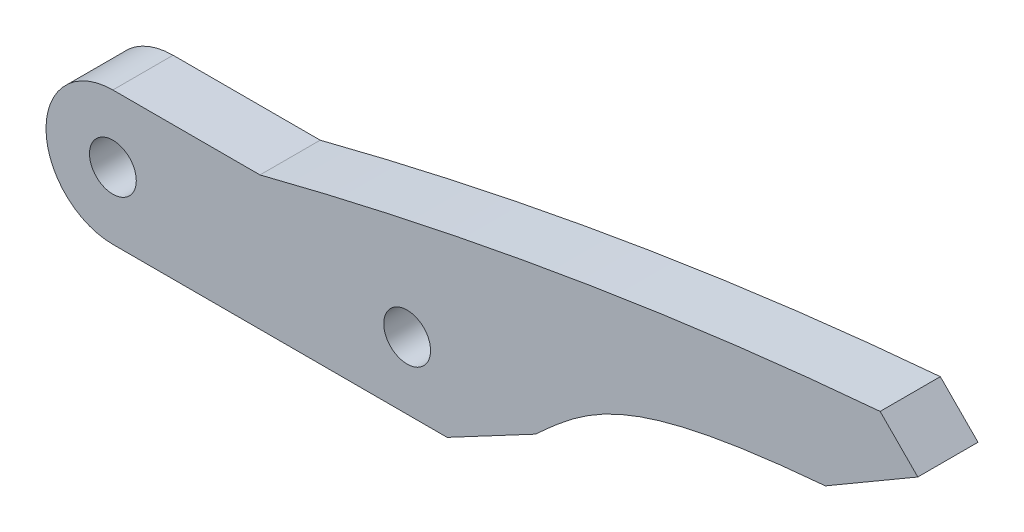
from build123d import *

# Parameters (mm, degrees)
SKETCH1_R           = 5
SKETCH1_R_2         = 1.75
BOSS_EXTRUDE1_DEPTH = 4.5
BOSS_EXTRUDE2_START = -4.5
BOSS_EXTRUDE2_DEPTH = 4.5
CUT_EXTRUDE3_START  = 2.2
CUT_EXTRUDE3_DEPTH  = 0.1


# Read off the part's stored shape, not the designer's step: Cut-Extrude3
with BuildPart() as part:
    # Sketch1 → Boss-Extrude1 (new body)
    # profile 1 of 3: a face of its own
    with BuildSketch(Plane.XY):
        with Locations((-11, 0)):
            Circle(SKETCH1_R)
        with Locations((-11, 0)):
            Circle(SKETCH1_R_2, mode=Mode.SUBTRACT)
    # profile 2 of 3: a face of its own
    with BuildSketch(Plane.XY):
        with Locations((11, 0)):
            Circle(SKETCH1_R)
        with Locations((11, 0)):
            Circle(SKETCH1_R_2, mode=Mode.SUBTRACT)
    # profile 3 of 3: a face of its own
    with BuildSketch(Plane.XY):
        with BuildLine():
            Line((11, 5), (-11, 5))
            ThreePointArc((-11, 5), (-7.464466094, 3.535533906), (-6, 0))
            ThreePointArc((-6, 0), (-7.464466094, -3.535533906), (-11, -5))
            Line((-11, -5), (11.000000019, -5))
            ThreePointArc((11.000000019, -5), (6, -9e-09), (11, 5))
        make_face()
    extrude(amount=BOSS_EXTRUDE1_DEPTH)

    # Sketch5 → Boss-Extrude2 (add)
    with BuildSketch(Plane.XY.offset(4.5).offset(BOSS_EXTRUDE2_START)):
        with BuildLine():
            Line((11, -5), (13.99, -5))
            Line((13.99, -5), (20.61, -1.48))
            add(Edge.make_bspline(
                [(42.27, 6), (27.826894641, 4.768168558), (24.733930665, 2.331798547), (20.61, -1.48)],
                knots=[0, 0, 0, 0, 1, 1, 1, 1], degree=3))
            Line((42.27, 6), (49.180795902, 10.03))
            Line((49.180795902, 10.03), (46.363989199, 12.87))
            add(Edge.make_bspline(
                [(0, 5), (22.856130072, 10.87555535), (46.363989199, 12.87)],
                knots=[0, 0, 0, 1, 1, 1], degree=2))
            Line((0, 5), (11, 5))
            ThreePointArc((11, 5), (16, 0), (11, -5))
        make_face()
    extrude(amount=BOSS_EXTRUDE2_DEPTH)

    # Cut-Extrude3 outline → Cut-Extrude3 (cut)
    with BuildSketch(Plane.XY.offset(CUT_EXTRUDE3_START)):
        with BuildLine():
            add(Edge.make_bspline(
                [(38.979397214, 11.642850201), (39.348659921, 11.684028726), (39.718010294, 11.724686129), (40.087448338, 11.76482241), (40.456974055, 11.804437571), (40.826587452, 11.843531609), (41.196288532, 11.882104526), (41.566077299, 11.920156321), (41.935953757, 11.957686995), (42.305917912, 11.994696547), (42.675969767, 12.031184976), (43.046109327, 12.067152283), (43.416336595, 12.102598468), (43.786651577, 12.13752353), (44.157054276, 12.17192747)],
                knots=[0.500328151, 0.500328151, 0.500328151, 0.500328151, 0.500328151, 0.500328151, 0.500328151, 0.500328151, 0.500328151, 0.500328151, 0.500328151, 0.500328151, 0.500328151, 0.500328151, 0.500328151, 0.500437892, 0.500437892, 0.500437892, 0.500437892, 0.500437892, 0.500437892, 0.500437892, 0.500437892, 0.500437892, 0.500437892, 0.500437892, 0.500437892, 0.500437892, 0.500437892, 0.500437892], degree=14))
            Line((38.979397214, 11.642850201), (42.27, 6))
            Line((42.27, 6), (46.363989199, 8.387391656))
            Line((46.363989199, 8.387391656), (44.157054276, 12.17192747))
        make_face()
    extrude(amount=CUT_EXTRUDE3_DEPTH, mode=Mode.SUBTRACT)


solid = part.part
